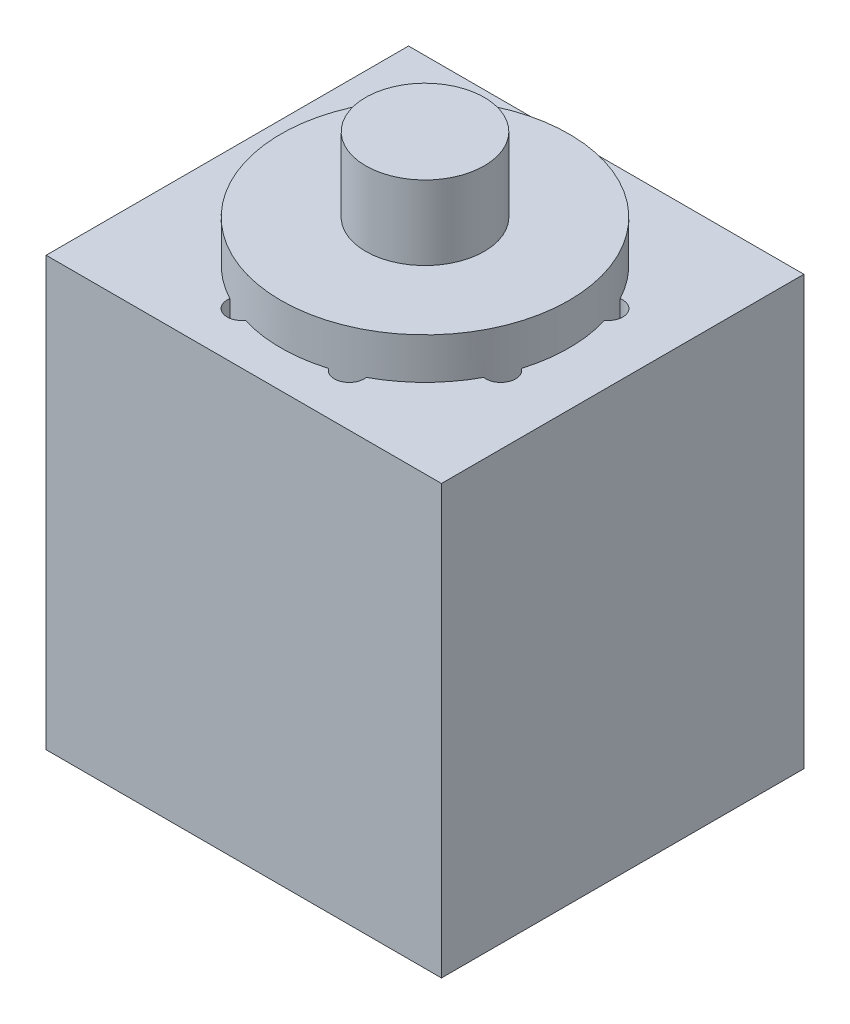
from build123d import *

# Parameters (mm, degrees)
F_01_HOUSING_PROFILE_W        = 240
F_01_HOUSING_PROFILE_H        = 220
F_01_HOUSING_PROFILE_R        = 9
F_01_HOUSING_BLOCK_DEPTH      = 260
F_02_FACE_BOSS_PROFILE_R      = 87.5
F_02_FACE_LOCATING_BOSS_DEPTH = 285
F_03_OUTPUT_SHAFT_PROFILE_R   = 36
F_03_OUTPUT_SHAFT_DEPTH       = 330


with BuildPart() as part:
    # 01_Housing_Profile → 01_Housing_Block (new body)
    with BuildSketch(Plane(origin=(0, 0, 0), x_dir=(1, 0, 0), z_dir=(0, 1, 0))):
        Rectangle(F_01_HOUSING_PROFILE_W, F_01_HOUSING_PROFILE_H)
        with Locations((78.529760263, 32.528091751)):
            Circle(F_01_HOUSING_PROFILE_R, mode=Mode.SUBTRACT)
        with Locations((32.528091751, 78.529760263)):
            Circle(F_01_HOUSING_PROFILE_R, mode=Mode.SUBTRACT)
        with Locations((-32.528091751, 78.529760263)):
            Circle(F_01_HOUSING_PROFILE_R, mode=Mode.SUBTRACT)
        with Locations((-78.529760263, 32.528091751)):
            Circle(F_01_HOUSING_PROFILE_R, mode=Mode.SUBTRACT)
        with Locations((-78.529760263, -32.528091751)):
            Circle(F_01_HOUSING_PROFILE_R, mode=Mode.SUBTRACT)
        with Locations((-32.528091751, -78.529760263)):
            Circle(F_01_HOUSING_PROFILE_R, mode=Mode.SUBTRACT)
        with Locations((32.528091751, -78.529760263)):
            Circle(F_01_HOUSING_PROFILE_R, mode=Mode.SUBTRACT)
        with Locations((78.529760263, -32.528091751)):
            Circle(F_01_HOUSING_PROFILE_R, mode=Mode.SUBTRACT)
    extrude(amount=F_01_HOUSING_BLOCK_DEPTH)

    # 02_Face_Boss_Profile → 02_Face_Locating_Boss (add)
    with BuildSketch(Plane(origin=(0, 0, 0), x_dir=(1, 0, 0), z_dir=(0, 1, 0))):
        Circle(F_02_FACE_BOSS_PROFILE_R)
    extrude(amount=F_02_FACE_LOCATING_BOSS_DEPTH)

    # 03_Output_Shaft_Profile → 03_Output_Shaft (add)
    with BuildSketch(Plane(origin=(0, 0, 0), x_dir=(1, 0, 0), z_dir=(0, 1, 0))):
        Circle(F_03_OUTPUT_SHAFT_PROFILE_R)
    extrude(amount=F_03_OUTPUT_SHAFT_DEPTH)


solid = part.part
